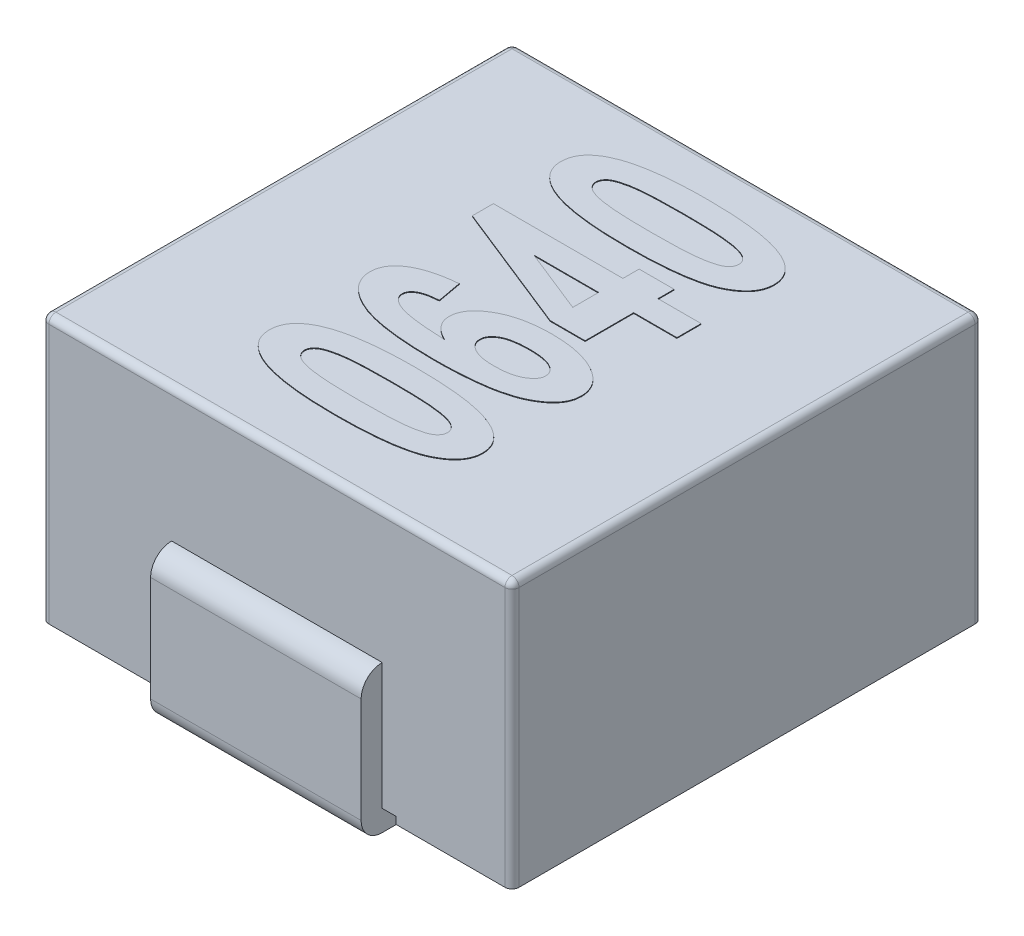
from build123d import *

# Parameters (mm, degrees)
EXTRUDE_1_DEPTH     = 3.8
SKETCH_2_W          = 3.4
SKETCH_2_H          = 2
CUT_EXTRUDE_1_DEPTH = 0.1
EXTRUDE_START       = -1.5
EXTRUDE_1_2_DEPTH   = 3
EXTRUDE_2_DEPTH     = 3
FILLET_1_R          = 0.1
EXTRUDE_2_2_DEPTH   = 0.01


# Read off the part's stored shape, not the designer's step: Вытянуть-Тонкостенный1, Вытянуть-Тонкостенный2
with BuildPart() as part:
    # Эскиз1 → Extrude 1 (new body)
    with BuildSketch(Plane(origin=(0, 0, 0), x_dir=(1, 0, 0), z_dir=(0, 1, 0))):
        with BuildLine():
            Line((-3.25, -3.35), (3.25, -3.35))
            ThreePointArc((3.25, -3.35), (3.320710678, -3.320710678), (3.35, -3.25))
            Line((3.35, -3.25), (3.35, 3.25))
            ThreePointArc((3.35, 3.25), (3.320710678, 3.320710678), (3.25, 3.35))
            Line((3.25, 3.35), (-3.25, 3.35))
            ThreePointArc((-3.25, 3.35), (-3.320710678, 3.320710678), (-3.35, 3.25))
            Line((-3.35, 3.25), (-3.35, -3.25))
            ThreePointArc((-3.35, -3.25), (-3.320710678, -3.320710678), (-3.25, -3.35))
        make_face()
    extrude(amount=EXTRUDE_1_DEPTH)

    # Эскиз2 → Вырез-Вытянуть1 (cut)
    with BuildSketch(Plane.XZ):
        with Locations((0, 2.35)):
            Rectangle(SKETCH_2_W, SKETCH_2_H)
        with Locations((0, -2.35)):
            Rectangle(SKETCH_2_W, SKETCH_2_H)
    extrude(amount=-CUT_EXTRUDE_1_DEPTH, mode=Mode.SUBTRACT)

    # Extrude 1 2 outline → Extrude 1 2 (add)
    with BuildSketch(Plane(origin=(0, 0, 0), x_dir=(0, 0, -1), z_dir=(1, 0, 0)).offset(EXTRUDE_START)):
        with BuildLine():
            Line((-3.35, -0.2), (-1.85, -0.2))
            Line((-1.85, -0.2), (-1.85, 0.1))
            Line((-1.85, 0.1), (-3.35, 0.1))
            Line((-3.35, 0.1), (-3.35, 1.9))
            ThreePointArc((-3.35, 1.9), (-3.562132034, 1.812132034), (-3.65, 1.6))
            Line((-3.65, 1.6), (-3.65, 0.1))
            ThreePointArc((-3.65, 0.1), (-3.562132034, -0.112132034), (-3.35, -0.2))
        make_face()
    extrude(amount=EXTRUDE_1_2_DEPTH)

    # Extrude 2 outline → Extrude 2 (add)
    with BuildSketch(Plane(origin=(0, 0, 0), x_dir=(0, 0, -1), z_dir=(1, 0, 0)).offset(EXTRUDE_START)):
        with BuildLine():
            Line((1.85, 0.1), (1.85, -0.2))
            Line((1.85, -0.2), (3.35, -0.2))
            ThreePointArc((3.35, -0.2), (3.562132034, -0.112132034), (3.65, 0.1))
            Line((3.65, 0.1), (3.65, 1.6))
            ThreePointArc((3.65, 1.6), (3.562132034, 1.812132034), (3.35, 1.9))
            Line((3.35, 1.9), (3.35, 0.1))
            Line((3.35, 0.1), (1.85, 0.1))
        make_face()
    extrude(amount=EXTRUDE_2_DEPTH)

    # Скругление1
    fillet_1_edges = [part.edges().sort_by_distance(p)[0] for p in [
        (3.320710678, 3.8, 3.320710678),
        (3.35, 3.8, 0),
        (3.320710678, 3.8, -3.320710678),
        (0, 3.8, -3.35),
        (-3.320710678, 3.8, -3.320710678),
        (-3.35, 3.8, 0),
        (-3.320710678, 3.8, 3.320710678),
        (0, 3.8, 3.35),
    ]]
    fillet(fillet_1_edges, radius=FILLET_1_R)

    # Эскиз4 → Extrude 2 2 (add)
    # profile 1 of 4: a face of its own
    with BuildSketch(Plane(origin=(0, 3.8, 0), x_dir=(1, 0, 0), z_dir=(0, 1, 0))):
        with BuildLine():
            add(Edge.make_bspline(
                [(-1.5, -1.957692308), (-1.499137143, -1.936566876), (-1.497447551, -1.895200382), (-1.482242122, -1.835098379), (-1.458087806, -1.778584119), (-1.423755807, -1.725761979), (-1.379856182, -1.676448664), (-1.325522016, -1.631842814), (-1.26298141, -1.589080556), (-1.216074382, -1.565892222), (-1.191706731, -1.553846154)],
                knots=[0, 0, 0, 0, 0.939629869, 1.83992419, 2.743264454, 3.666481804, 4.633505536, 5.672028627, 6.790646185, 8, 8, 8, 8], degree=3))
            add(Edge.make_bspline(
                [(-1.191706731, -1.553846154), (-1.158904384, -1.53955104), (-1.089763949, -1.509419953), (-0.974752135, -1.475847916), (-0.845845006, -1.445625948), (-0.701374134, -1.422391671), (-0.542246126, -1.402919805), (-0.367938846, -1.39061196), (-0.178780437, -1.381621929), (-0.047688732, -1.381060813), (0.020432692, -1.380769231)],
                knots=[0, 0, 0, 0, 0.695993191, 1.467006985, 2.327867947, 3.272915826, 4.313905632, 5.448135814, 6.673931191, 8, 8, 8, 8], degree=3))
            add(Edge.make_bspline(
                [(0.020432692, -1.380769231), (0.088346822, -1.38142732), (0.219213706, -1.382695421), (0.408266166, -1.390058637), (0.582217851, -1.404033081), (0.741553906, -1.421993189), (0.886013143, -1.446535154), (1.015745714, -1.476191084), (1.131109184, -1.510782717), (1.200752724, -1.540810484), (1.233774038, -1.555048077)],
                knots=[0, 0, 0, 0, 1.320779415, 2.545071084, 3.678366063, 4.713891943, 5.66240021, 6.526117529, 7.301162213, 8, 8, 8, 8], degree=3))
            add(Edge.make_bspline(
                [(1.233774038, -1.555048077), (1.257897503, -1.567159433), (1.304232457, -1.590422224), (1.366586207, -1.632149894), (1.419375705, -1.677271606), (1.462958308, -1.725975571), (1.497291664, -1.778447599), (1.520545201, -1.835248332), (1.53595582, -1.895181056), (1.537614479, -1.936560343), (1.538461538, -1.957692308)],
                knots=[0, 0, 0, 0, 1.209008214, 2.322193053, 3.353572777, 4.313995313, 5.243012364, 6.148517307, 7.054467326, 8, 8, 8, 8], degree=3))
            add(Edge.make_bspline(
                [(1.538461538, -1.957692308), (1.537411817, -1.978827802), (1.535332896, -2.02068559), (1.518925325, -2.081659932), (1.492824036, -2.139688165), (1.455493603, -2.194066787), (1.407742305, -2.245076498), (1.349426407, -2.292430364), (1.280976264, -2.336770497), (1.20193948, -2.378856542), (1.109155229, -2.416617895), (1.000326036, -2.447366483), (0.875989924, -2.475078094), (0.73501802, -2.496736352), (0.57803189, -2.514064356), (0.404573204, -2.525324635), (0.215024127, -2.533630888), (0.083143563, -2.534278123), (0.014423077, -2.534615385)],
                knots=[0, 0, 0, 0, 0.570946305, 1.130730606, 1.695682016, 2.284720325, 2.905752519, 3.57931678, 4.311109974, 5.108472247, 5.997836566, 7.014420583, 8.163245194, 9.441390503, 10.869501499, 12.433562194, 14.141596213, 16, 16, 16, 16], degree=3))
            add(Edge.make_bspline(
                [(0.014423077, -2.534615385), (-0.053091481, -2.533963284), (-0.183359594, -2.532705068), (-0.371596935, -2.525242226), (-0.545219308, -2.51161966), (-0.703981404, -2.492416926), (-0.848231491, -2.469095664), (-0.97745489, -2.439051032), (-1.092651154, -2.404620183), (-1.162292314, -2.374580012), (-1.1953125, -2.360336538)],
                knots=[0, 0, 0, 0, 1.316839064, 2.540817049, 3.673540427, 4.712565747, 5.659351526, 6.521795573, 7.299112968, 8, 8, 8, 8], degree=3))
            add(Edge.make_bspline(
                [(-1.1953125, -2.360336538), (-1.219440057, -2.348228581), (-1.265782873, -2.324972317), (-1.32808256, -2.283199756), (-1.381170251, -2.238132726), (-1.424095116, -2.188901849), (-1.459027623, -2.136872971), (-1.482048346, -2.080111905), (-1.497503564, -2.020209967), (-1.499156079, -1.978826439), (-1.5, -1.957692308)],
                knots=[0, 0, 0, 0, 1.209129629, 2.322426261, 3.353909562, 4.321163245, 5.242735491, 6.14833137, 7.05437237, 8, 8, 8, 8], degree=3))
        make_face()
        with BuildLine():
            add(Edge.make_bspline(
                [(-1, -1.957692308), (-0.999127679, -1.968216797), (-0.997360051, -1.989543107), (-0.98464763, -2.020189646), (-0.963752812, -2.048548502), (-0.934793713, -2.075564705), (-0.894910908, -2.09990752), (-0.842840464, -2.120448699), (-0.778433667, -2.137921563), (-0.731044768, -2.146944568), (-0.705528846, -2.151802885)],
                knots=[0, 0, 0, 0, 0.66053735, 1.338480494, 2.051183008, 2.861689582, 3.811811342, 4.969049189, 6.368024884, 8, 8, 8, 8], degree=3))
            add(Edge.make_bspline(
                [(-0.705528846, -2.151802885), (-0.686111734, -2.154704884), (-0.644159002, -2.160974962), (-0.576454743, -2.168853117), (-0.499229717, -2.1742951), (-0.413125803, -2.180127901), (-0.317716076, -2.183163637), (-0.213360006, -2.186421571), (-0.099564736, -2.188131724), (-0.020633397, -2.188348668), (0.020432692, -2.188461538)],
                knots=[0, 0, 0, 0, 0.647628605, 1.399270384, 2.247685976, 3.201110699, 4.24594481, 5.39623077, 6.6453211, 8, 8, 8, 8], degree=3))
            add(Edge.make_bspline(
                [(0.020432692, -2.188461538), (0.061297689, -2.188275136), (0.13962396, -2.187917856), (0.252024839, -2.187185067), (0.354384455, -2.183885271), (0.446927652, -2.18023517), (0.529543314, -2.176665945), (0.602017058, -2.17022466), (0.664624604, -2.164110466), (0.732465088, -2.153898049), (0.803572683, -2.140125262), (0.875380999, -2.120604957), (0.93178471, -2.099804879), (0.973513657, -2.07550215), (1.002243275, -2.048087616), (1.023951014, -2.020532594), (1.035633028, -1.989383166), (1.037524767, -1.968187963), (1.038461538, -1.957692308)],
                knots=[0, 0, 0, 0, 1.772229522, 3.396846643, 4.874325468, 6.213183949, 7.413572011, 8.459660885, 9.368179202, 10.14095794, 11.434081607, 12.506883432, 13.365124891, 14.035567992, 14.582591736, 15.079517174, 15.544185971, 16, 16, 16, 16], degree=3))
            add(Edge.make_bspline(
                [(1.038461538, -1.957692308), (1.037650183, -1.946944638), (1.036035603, -1.925557014), (1.022740293, -1.895014588), (1.002646122, -1.866265058), (0.972969063, -1.83991199), (0.933432472, -1.815419158), (0.881280735, -1.794956445), (0.816902053, -1.777456443), (0.769508703, -1.768437735), (0.743990385, -1.763581731)],
                knots=[0, 0, 0, 0, 0.672803919, 1.338864841, 2.061605897, 2.863308736, 3.813131099, 4.970004284, 6.368539142, 8, 8, 8, 8], degree=3))
            add(Edge.make_bspline(
                [(0.743990385, -1.763581731), (0.724572687, -1.760684675), (0.682815507, -1.754454644), (0.615519911, -1.746519364), (0.538893118, -1.741091016), (0.453191294, -1.735236285), (0.357980214, -1.732225337), (0.253624515, -1.728961702), (0.140029441, -1.727256369), (0.061298449, -1.727036962), (0.020432692, -1.726923077)],
                knots=[0, 0, 0, 0, 0.649769229, 1.397309303, 2.24191953, 3.191878681, 4.240166309, 5.394254338, 6.647473319, 8, 8, 8, 8], degree=3))
            add(Edge.make_bspline(
                [(0.020432692, -1.726923077), (-0.020432322, -1.727108707), (-0.098758626, -1.727464505), (-0.211359517, -1.728208719), (-0.313919908, -1.731488821), (-0.40666384, -1.735142837), (-0.489476366, -1.73875147), (-0.562156311, -1.745124382), (-0.62496015, -1.751282622), (-0.692610398, -1.761433922), (-0.763505543, -1.775316331), (-0.835258867, -1.79490132), (-0.892136546, -1.815562221), (-0.934274946, -1.839978234), (-0.963909922, -1.866874521), (-0.98462943, -1.895212168), (-0.997364372, -1.925837425), (-0.999129107, -1.947166469), (-1, -1.957692308)],
                knots=[0, 0, 0, 0, 1.769047239, 3.390747135, 4.874240912, 6.210695287, 7.408927887, 8.461780351, 9.368667298, 10.140058405, 11.422355672, 12.493231132, 13.358012728, 14.034682899, 14.587091034, 15.078019327, 15.545004449, 16, 16, 16, 16], degree=3))
        make_face(mode=Mode.SUBTRACT)
    # profile 2 of 4: a face of its own
    with BuildSketch(Plane(origin=(0, 3.8, 0), x_dir=(1, 0, 0), z_dir=(0, 1, 0))):
        with BuildLine():
            Line((-0.716947115, -0.034615385), (-0.653846154, -0.380769231))
            add(Edge.make_bspline(
                [(-0.653846154, -0.380769231), (-0.681547205, -0.382889175), (-0.733200789, -0.386842193), (-0.804831062, -0.399473341), (-0.865288637, -0.416090973), (-0.914169487, -0.438291327), (-0.952438737, -0.464341137), (-0.979725566, -0.494738618), (-0.996995203, -0.529605986), (-0.99898864, -0.554458508), (-1, -0.567067308)],
                knots=[0, 0, 0, 0, 1.549919711, 2.8901037, 4.054353795, 5.039938989, 5.874463713, 6.61920834, 7.299462416, 8, 8, 8, 8], degree=3))
            add(Edge.make_bspline(
                [(-1, -0.567067308), (-0.999654476, -0.575566657), (-0.99896188, -0.592603468), (-0.98950017, -0.617077399), (-0.976354433, -0.640877904), (-0.957197105, -0.663312067), (-0.932677568, -0.684107646), (-0.903627614, -0.704983619), (-0.868638664, -0.723635404), (-0.827958571, -0.742415177), (-0.778668125, -0.759259885), (-0.719275561, -0.774771817), (-0.648460203, -0.787425798), (-0.566873386, -0.799268821), (-0.474338721, -0.810310047), (-0.370650905, -0.818109574), (-0.255880051, -0.825624574), (-0.17549124, -0.828686016), (-0.133413462, -0.830288462)],
                knots=[0, 0, 0, 0, 0.421598826, 0.845088239, 1.292540369, 1.774895999, 2.30602329, 2.893820393, 3.555766604, 4.280231038, 5.127209864, 6.150050241, 7.339703188, 8.713347625, 10.262722907, 11.9871774, 13.89957508, 16, 16, 16, 16], degree=3))
            add(Edge.make_bspline(
                [(-0.133413462, -0.830288462), (-0.153226041, -0.819580375), (-0.19108179, -0.799120512), (-0.242718247, -0.764788806), (-0.286608857, -0.728348218), (-0.321502927, -0.688749083), (-0.350077859, -0.648240126), (-0.370205963, -0.605180581), (-0.381933675, -0.559868017), (-0.383717932, -0.529071749), (-0.384615385, -0.513581731)],
                knots=[0, 0, 0, 0, 1.267157945, 2.421149296, 3.485202224, 4.467489562, 5.383884497, 6.266713326, 7.128185226, 8, 8, 8, 8], degree=3))
            add(Edge.make_bspline(
                [(-0.384615385, -0.513581731), (-0.383753764, -0.496092925), (-0.382039735, -0.461302267), (-0.369774534, -0.40992183), (-0.348123112, -0.360966415), (-0.319073969, -0.313802855), (-0.28172485, -0.268656146), (-0.23557482, -0.226326612), (-0.181677232, -0.185291033), (-0.12020114, -0.146556207), (-0.052015436, -0.111758018), (0.020926011, -0.079830438), (0.099461039, -0.054651517), (0.182180379, -0.032638342), (0.270071765, -0.016824283), (0.362307799, -0.004782102), (0.459617513, 0.002554479), (0.526028935, 0.003408212), (0.560096154, 0.003846154)],
                knots=[0, 0, 0, 0, 0.712118958, 1.416625472, 2.136553801, 2.883795801, 3.66624321, 4.51480892, 5.428643096, 6.422356621, 7.469656695, 8.544188354, 9.661363121, 10.824973369, 12.028350145, 13.295373735, 14.612601657, 16, 16, 16, 16], degree=3))
            add(Edge.make_bspline(
                [(0.560096154, 0.003846154), (0.596168309, 0.003421893), (0.666384952, 0.002596043), (0.769063955, -0.004896221), (0.866298056, -0.016328939), (0.957852718, -0.034227442), (1.044263907, -0.05525344), (1.124753742, -0.082731392), (1.200519276, -0.113530758), (1.26974538, -0.150376182), (1.332843965, -0.189815334), (1.38725083, -0.23361695), (1.434194106, -0.279210116), (1.472474655, -0.328003059), (1.501748007, -0.38000015), (1.523067826, -0.434539702), (1.53609788, -0.492139584), (1.537668448, -0.531544161), (1.538461538, -0.551442308)],
                knots=[0, 0, 0, 0, 1.39498986, 2.71543254, 3.980142828, 5.179086445, 6.321625476, 7.416841902, 8.465806243, 9.481271331, 10.446328925, 11.339337795, 12.177594524, 12.972664813, 13.729001214, 14.477197864, 15.231029898, 16, 16, 16, 16], degree=3))
            add(Edge.make_bspline(
                [(1.538461538, -0.551442308), (1.537427146, -0.572777842), (1.535366803, -0.615274755), (1.518481686, -0.677481166), (1.490480293, -0.736422249), (1.45069746, -0.791763062), (1.401339194, -0.844850442), (1.340291423, -0.894127013), (1.268586086, -0.940394461), (1.186011794, -0.984335233), (1.090810257, -1.024609906), (0.981459802, -1.05696177), (0.859116341, -1.087065691), (0.722201649, -1.109467722), (0.571499521, -1.128453191), (0.406581412, -1.139980044), (0.228067882, -1.149182415), (0.104381233, -1.149720874), (0.040264423, -1.15)],
                knots=[0, 0, 0, 0, 0.582864578, 1.16097142, 1.749167969, 2.358718482, 3.017750106, 3.726302687, 4.498298734, 5.348834351, 6.281956375, 7.320036994, 8.464218828, 9.726176242, 11.111856478, 12.61750766, 14.246580185, 16, 16, 16, 16], degree=3))
            add(Edge.make_bspline(
                [(0.040264423, -1.15), (-0.025447276, -1.149345796), (-0.152311215, -1.148082781), (-0.335546367, -1.140643622), (-0.504560877, -1.126987543), (-0.659125219, -1.10779629), (-0.799750296, -1.084409689), (-0.926046606, -1.054514414), (-1.038405685, -1.019590677), (-1.136586221, -0.978467516), (-1.221972319, -0.933227902), (-1.296065858, -0.884767436), (-1.358167243, -0.832084508), (-1.410522361, -0.777569442), (-1.450234722, -0.718215697), (-1.478642787, -0.655712732), (-1.497291946, -0.589966759), (-1.49909323, -0.544754917), (-1.5, -0.521995192)],
                knots=[0, 0, 0, 0, 1.739098909, 3.357529062, 4.85223663, 6.225247106, 7.478570524, 8.623010299, 9.657512328, 10.588950926, 11.435634555, 12.211994303, 12.92677536, 13.586936376, 14.20596628, 14.806185805, 15.399031722, 16, 16, 16, 16], degree=3))
            add(Edge.make_bspline(
                [(-1.5, -0.521995192), (-1.499509835, -0.505912065), (-1.498544734, -0.474245452), (-1.48823713, -0.428027115), (-1.472908661, -0.383689243), (-1.45008245, -0.342235737), (-1.422204146, -0.30221565), (-1.386808754, -0.265294978), (-1.345917612, -0.229675703), (-1.298656162, -0.196710911), (-1.245690419, -0.165926024), (-1.186493628, -0.138726176), (-1.122305644, -0.113139062), (-1.051964992, -0.091975207), (-0.976507625, -0.072427191), (-0.894885635, -0.057345975), (-0.807953117, -0.043816558), (-0.74783237, -0.037738042), (-0.716947115, -0.034615385)],
                knots=[0, 0, 0, 0, 0.76381956, 1.50391014, 2.242342492, 2.988420858, 3.747230929, 4.55625529, 5.414143539, 6.323616016, 7.292829522, 8.324445395, 9.419800476, 10.577190305, 11.815979938, 13.12605627, 14.523596504, 16, 16, 16, 16], degree=3))
        make_face()
        with BuildLine():
            add(Edge.make_bspline(
                [(0.546875, -0.803846154), (0.583979099, -0.802982954), (0.653869542, -0.801357004), (0.752205069, -0.787904535), (0.837302066, -0.764872177), (0.908736182, -0.732952461), (0.964873214, -0.693863458), (1.006703356, -0.652463235), (1.033893336, -0.606715693), (1.036965076, -0.573993964), (1.038461538, -0.558052885)],
                knots=[0, 0, 0, 0, 1.487550157, 2.801996091, 3.96948146, 5.011955507, 5.923443518, 6.696061968, 7.364759143, 8, 8, 8, 8], degree=3))
            add(Edge.make_bspline(
                [(1.038461538, -0.558052885), (1.037247589, -0.542975729), (1.034821752, -0.512847031), (1.01275913, -0.470990618), (0.979139196, -0.433336895), (0.940843155, -0.407605158), (0.904366542, -0.388787238), (0.871658869, -0.37638195), (0.834963082, -0.36540953), (0.793808605, -0.357538593), (0.748802939, -0.349978418), (0.699405743, -0.345359083), (0.645851915, -0.343266067), (0.608775561, -0.342635026), (0.589543269, -0.342307692)],
                knots=[0, 0, 0, 0, 0.98415851, 1.96664515, 3.038345339, 4.2755351, 4.969759699, 5.731949388, 6.568604871, 7.481899529, 8.481065577, 9.564888458, 10.736856013, 12, 12, 12, 12], degree=3))
            add(Edge.make_bspline(
                [(0.589543269, -0.342307692), (0.569708839, -0.342582964), (0.531418978, -0.343114368), (0.476051528, -0.345911797), (0.424928736, -0.351378852), (0.377810294, -0.358615233), (0.33470023, -0.367193062), (0.295721336, -0.378754893), (0.260906126, -0.392429778), (0.221493613, -0.412585751), (0.180059321, -0.440438597), (0.143547098, -0.480900385), (0.119316595, -0.526029455), (0.11669742, -0.558569706), (0.115384615, -0.574879808)],
                knots=[0, 0, 0, 0, 1.22920971, 2.372957979, 3.434023047, 4.413685549, 5.326664308, 6.15541423, 6.929955182, 7.640580054, 8.897558011, 9.996505919, 10.995791649, 12, 12, 12, 12], degree=3))
            add(Edge.make_bspline(
                [(0.115384615, -0.574879808), (0.116603075, -0.590534425), (0.119054708, -0.622032703), (0.141364485, -0.666457866), (0.177501245, -0.705244394), (0.225416305, -0.741153975), (0.287618906, -0.769565278), (0.36277845, -0.789326477), (0.45050488, -0.801900588), (0.513373049, -0.803169801), (0.546875, -0.803846154)],
                knots=[0, 0, 0, 0, 0.695405127, 1.39920786, 2.165432477, 3.046964329, 4.054821068, 5.195738149, 6.505630974, 8, 8, 8, 8], degree=3))
        make_face(mode=Mode.SUBTRACT)
    # profile 3 of 4: a face of its own
    with BuildSketch(Plane(origin=(0, 3.8, 0), x_dir=(1, 0, 0), z_dir=(0, 1, 0))):
        Polygon((1.5, 0.85), (0.884615385, 0.85), (0.884615385, 0.157692308), (0.386418269, 0.157692308), (-1.461538462, 0.895673077), (-1.461538462, 1.196153846), (0.384615385, 1.196153846), (0.384615385, 1.426923077), (0.884615385, 1.426923077), (0.884615385, 1.196153846), (1.5, 1.196153846), align=None)
        Polygon((0.384615385, 0.85), (-0.538461538, 0.85), (0.384615385, 0.481009615), align=None, mode=Mode.SUBTRACT)
    # profile 4 of 4: a face of its own
    with BuildSketch(Plane(origin=(0, 3.8, 0), x_dir=(1, 0, 0), z_dir=(0, 1, 0))):
        with BuildLine():
            add(Edge.make_bspline(
                [(-1.5, 2.196153846), (-1.499137143, 2.217279278), (-1.497447551, 2.258645772), (-1.482242122, 2.318747775), (-1.458087806, 2.375262035), (-1.423755807, 2.428084175), (-1.379856182, 2.47739749), (-1.325522016, 2.52200334), (-1.26298141, 2.564765598), (-1.216074382, 2.587953932), (-1.191706731, 2.6)],
                knots=[0, 0, 0, 0, 0.939629869, 1.83992419, 2.743264454, 3.666481804, 4.633505536, 5.672028627, 6.790646185, 8, 8, 8, 8], degree=3))
            add(Edge.make_bspline(
                [(-1.191706731, 2.6), (-1.158904384, 2.614295114), (-1.089763949, 2.644426201), (-0.974752135, 2.677998238), (-0.845845006, 2.708220205), (-0.701374134, 2.731454483), (-0.542246126, 2.750926349), (-0.367938846, 2.763234194), (-0.178780437, 2.772224225), (-0.047688732, 2.772785341), (0.020432692, 2.773076923)],
                knots=[0, 0, 0, 0, 0.695993191, 1.467006985, 2.327867947, 3.272915826, 4.313905632, 5.448135814, 6.673931191, 8, 8, 8, 8], degree=3))
            add(Edge.make_bspline(
                [(0.020432692, 2.773076923), (0.088346822, 2.772418834), (0.219213706, 2.771150733), (0.408266166, 2.763787517), (0.582217851, 2.749813073), (0.741553906, 2.731852965), (0.886013143, 2.707311), (1.015745714, 2.67765507), (1.131109184, 2.643063437), (1.200752724, 2.61303567), (1.233774038, 2.598798077)],
                knots=[0, 0, 0, 0, 1.320779415, 2.545071084, 3.678366063, 4.713891943, 5.66240021, 6.526117529, 7.301162213, 8, 8, 8, 8], degree=3))
            add(Edge.make_bspline(
                [(1.233774038, 2.598798077), (1.257897503, 2.586686721), (1.304232457, 2.56342393), (1.366586207, 2.52169626), (1.419375705, 2.476574548), (1.462958308, 2.427870583), (1.497291664, 2.375398555), (1.520545201, 2.318597822), (1.53595582, 2.258665098), (1.537614479, 2.217285811), (1.538461538, 2.196153846)],
                knots=[0, 0, 0, 0, 1.209008214, 2.322193053, 3.353572777, 4.313995313, 5.243012364, 6.148517307, 7.054467326, 8, 8, 8, 8], degree=3))
            add(Edge.make_bspline(
                [(1.538461538, 2.196153846), (1.537411817, 2.175018352), (1.535332896, 2.133160563), (1.518925325, 2.072186222), (1.492824036, 2.014157989), (1.455493603, 1.959779367), (1.407742305, 1.908769656), (1.349426407, 1.86141579), (1.280976264, 1.817075657), (1.20193948, 1.774989612), (1.109155229, 1.737228259), (1.000326036, 1.706479671), (0.875989924, 1.67876806), (0.73501802, 1.657109802), (0.57803189, 1.639781798), (0.404573204, 1.628521519), (0.215024127, 1.620215266), (0.083143563, 1.619568031), (0.014423077, 1.619230769)],
                knots=[0, 0, 0, 0, 0.570946305, 1.130730606, 1.695682016, 2.284720325, 2.905752519, 3.57931678, 4.311109974, 5.108472247, 5.997836566, 7.014420583, 8.163245194, 9.441390503, 10.869501499, 12.433562194, 14.141596213, 16, 16, 16, 16], degree=3))
            add(Edge.make_bspline(
                [(0.014423077, 1.619230769), (-0.053091481, 1.61988287), (-0.183359594, 1.621141086), (-0.371596935, 1.628603928), (-0.545219308, 1.642226494), (-0.703981404, 1.661429228), (-0.848231491, 1.68475049), (-0.97745489, 1.714795122), (-1.092651154, 1.749225971), (-1.162292314, 1.779266142), (-1.1953125, 1.793509615)],
                knots=[0, 0, 0, 0, 1.316839064, 2.540817049, 3.673540427, 4.712565747, 5.659351526, 6.521795573, 7.299112968, 8, 8, 8, 8], degree=3))
            add(Edge.make_bspline(
                [(-1.1953125, 1.793509615), (-1.219440057, 1.805617573), (-1.265782873, 1.828873837), (-1.32808256, 1.870646398), (-1.381170251, 1.915713428), (-1.424095116, 1.964944305), (-1.459027623, 2.016973183), (-1.482048346, 2.073734248), (-1.497503564, 2.133636187), (-1.499156079, 2.175019715), (-1.5, 2.196153846)],
                knots=[0, 0, 0, 0, 1.209129629, 2.322426261, 3.353909562, 4.321163245, 5.242735491, 6.14833137, 7.05437237, 8, 8, 8, 8], degree=3))
        make_face()
        with BuildLine():
            add(Edge.make_bspline(
                [(-1, 2.196153846), (-0.999127679, 2.185629357), (-0.997360051, 2.164303047), (-0.98464763, 2.133656508), (-0.963752812, 2.105297652), (-0.934793713, 2.078281449), (-0.894910908, 2.053938634), (-0.842840464, 2.033397455), (-0.778433667, 2.01592459), (-0.731044768, 2.006901586), (-0.705528846, 2.002043269)],
                knots=[0, 0, 0, 0, 0.66053735, 1.338480494, 2.051183008, 2.861689582, 3.811811342, 4.969049189, 6.368024884, 8, 8, 8, 8], degree=3))
            add(Edge.make_bspline(
                [(-0.705528846, 2.002043269), (-0.686111734, 1.99914127), (-0.644159002, 1.992871192), (-0.576454743, 1.984993036), (-0.499229717, 1.979551054), (-0.413125803, 1.973718253), (-0.317716076, 1.970682517), (-0.213360006, 1.967424583), (-0.099564736, 1.96571443), (-0.020633397, 1.965497486), (0.020432692, 1.965384615)],
                knots=[0, 0, 0, 0, 0.647628605, 1.399270384, 2.247685976, 3.201110699, 4.24594481, 5.39623077, 6.6453211, 8, 8, 8, 8], degree=3))
            add(Edge.make_bspline(
                [(0.020432692, 1.965384615), (0.061297689, 1.965571018), (0.13962396, 1.965928298), (0.252024839, 1.966661087), (0.354384455, 1.969960883), (0.446927652, 1.973610983), (0.529543314, 1.977180209), (0.602017058, 1.983621494), (0.664624604, 1.989735688), (0.732465088, 1.999948105), (0.803572683, 2.013720892), (0.875380999, 2.033241197), (0.93178471, 2.054041275), (0.973513657, 2.078344004), (1.002243275, 2.105758538), (1.023951014, 2.133313559), (1.035633028, 2.164462988), (1.037524767, 2.185658191), (1.038461538, 2.196153846)],
                knots=[0, 0, 0, 0, 1.772229522, 3.396846643, 4.874325468, 6.213183949, 7.413572011, 8.459660885, 9.368179202, 10.14095794, 11.434081607, 12.506883432, 13.365124891, 14.035567992, 14.582591736, 15.079517174, 15.544185971, 16, 16, 16, 16], degree=3))
            add(Edge.make_bspline(
                [(1.038461538, 2.196153846), (1.037650183, 2.206901516), (1.036035603, 2.22828914), (1.022740293, 2.258831566), (1.002646122, 2.287581096), (0.972969063, 2.313934164), (0.933432472, 2.338426996), (0.881280735, 2.358889709), (0.816902053, 2.37638971), (0.769508703, 2.385408419), (0.743990385, 2.390264423)],
                knots=[0, 0, 0, 0, 0.672803919, 1.338864841, 2.061605897, 2.863308736, 3.813131099, 4.970004284, 6.368539142, 8, 8, 8, 8], degree=3))
            add(Edge.make_bspline(
                [(0.743990385, 2.390264423), (0.724572687, 2.393161478), (0.682815507, 2.39939151), (0.615519911, 2.407326789), (0.538893118, 2.412755138), (0.453191294, 2.418609869), (0.357980214, 2.421620816), (0.253624515, 2.424884452), (0.140029441, 2.426589785), (0.061298449, 2.426809192), (0.020432692, 2.426923077)],
                knots=[0, 0, 0, 0, 0.649769229, 1.397309303, 2.24191953, 3.191878681, 4.240166309, 5.394254338, 6.647473319, 8, 8, 8, 8], degree=3))
            add(Edge.make_bspline(
                [(0.020432692, 2.426923077), (-0.020432322, 2.426737447), (-0.098758626, 2.426381649), (-0.211359517, 2.425637435), (-0.313919908, 2.422357332), (-0.40666384, 2.418703317), (-0.489476366, 2.415094684), (-0.562156311, 2.408721772), (-0.62496015, 2.402563531), (-0.692610398, 2.392412232), (-0.763505543, 2.378529823), (-0.835258867, 2.358944834), (-0.892136546, 2.338283933), (-0.934274946, 2.313867919), (-0.963909922, 2.286971633), (-0.98462943, 2.258633985), (-0.997364372, 2.228008729), (-0.999129107, 2.206679685), (-1, 2.196153846)],
                knots=[0, 0, 0, 0, 1.769047239, 3.390747135, 4.874240912, 6.210695287, 7.408927887, 8.461780351, 9.368667298, 10.140058405, 11.422355672, 12.493231132, 13.358012728, 14.034682899, 14.587091034, 15.078019327, 15.545004449, 16, 16, 16, 16], degree=3))
        make_face(mode=Mode.SUBTRACT)
    extrude(amount=EXTRUDE_2_2_DEPTH)


solid = part.part
